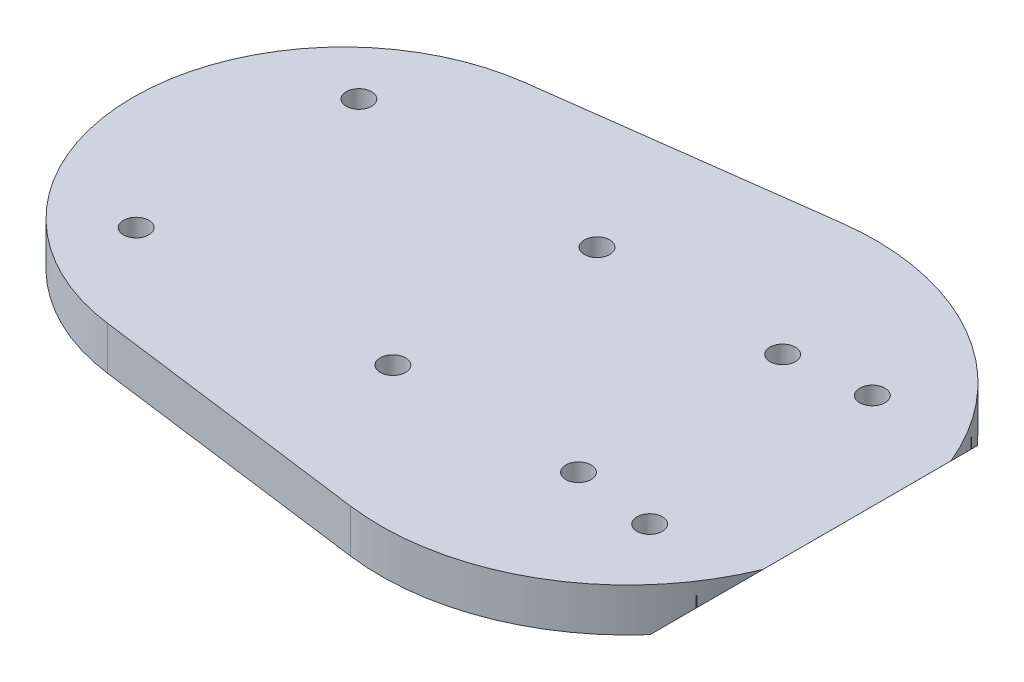
from build123d import *

# Parameters (mm, degrees)
BOSS_EXTRUDE1_DEPTH  = 2
BOSS_EXTRUDE2_DEPTH  = 5
SKETCH3_W            = 1.6
SKETCH3_H            = 48.763225696
BOSS_EXTRUDE3_DEPTH  = 5
SKETCH4_W            = 1.6
SKETCH4_H            = 64.120558948
BOSS_EXTRUDE4_DEPTH  = 5
SKETCH5_W            = 1.6
SKETCH5_H            = 65.99612555
BOSS_EXTRUDE5_DEPTH  = 5
SKETCH6_W            = 1.6
SKETCH6_H            = 66.50657452
BOSS_EXTRUDE6_DEPTH  = 5
SKETCH7_W            = 1.6
SKETCH7_H            = 44.463972346
BOSS_EXTRUDE7_DEPTH  = 5
BOSS_EXTRUDE8_DEPTH  = 5
SKETCH9_R            = 5.05
BOSS_EXTRUDE9_DEPTH  = 5
SKETCH10_R           = 5.05
BOSS_EXTRUDE10_DEPTH = 5
SKETCH11_R           = 5.05
BOSS_EXTRUDE11_DEPTH = 5
SKETCH12_R           = 5.05
BOSS_EXTRUDE12_DEPTH = 5
SKETCH13_R           = 5.05
BOSS_EXTRUDE13_DEPTH = 5
SKETCH14_R           = 5.05
BOSS_EXTRUDE14_DEPTH = 5
SKETCH15_R           = 5.05
BOSS_EXTRUDE15_DEPTH = 5
SKETCH16_R           = 5.05
BOSS_EXTRUDE16_DEPTH = 5
SKETCH17_R           = 0.5
BOSS_EXTRUDE17_DEPTH = 1.2
SKETCH18_R           = 2.05
CUT_EXTRUDE1_DEPTH   = 6.7
SKETCH19_R           = 2.05
CUT_EXTRUDE2_DEPTH   = 6.7
SKETCH20_R           = 1.6
CUT_EXTRUDE3_DEPTH   = 8
CUT_EXTRUDE4_DEPTH   = 160


with BuildPart() as part:
    # Sketch1 → Boss-Extrude1 (new body)
    with BuildSketch(Plane(origin=(0, 28, 0), x_dir=(1, 0, 0), z_dir=(0, 1, 0))):
        with BuildLine():
            Line((256.074935441, -319.290465693), (301.292326745, -313.341724344))
            ThreePointArc((301.292326745, -313.341724344), (346.50971805, -353), (301.292326745, -392.658275656))
            Line((301.292326745, -392.658275656), (256.074935441, -386.709534307))
            ThreePointArc((256.074935441, -386.709534307), (226.50971805, -353), (256.074935441, -319.290465693))
        make_face()
    extrude(amount=BOSS_EXTRUDE1_DEPTH)

    # Sketch2 → Boss-Extrude2 (add)
    with BuildSketch(Plane(origin=(0, 23, 0), x_dir=(1, 0, 0), z_dir=(0, 1, 0))):
        with BuildLine():
            Line((256.074935441, -319.290465693), (301.292326745, -313.341724344))
            ThreePointArc((301.292326745, -313.341724344), (346.50971805, -353), (301.292326745, -392.658275656))
            Line((301.292326745, -392.658275656), (256.074935441, -386.709534307))
            ThreePointArc((256.074935441, -386.709534307), (226.50971805, -353), (256.074935441, -319.290465693))
        make_face()
        with BuildLine():
            Line((256.283631093, -320.876796719), (301.501022397, -314.928055371))
            ThreePointArc((301.501022397, -314.928055371), (344.90971805, -353), (301.501022397, -391.071944629))
            Line((301.501022397, -391.071944629), (256.283631093, -385.123203281))
            ThreePointArc((256.283631093, -385.123203281), (228.10971805, -353), (256.283631093, -320.876796719))
        make_face(mode=Mode.SUBTRACT)
    extrude(amount=BOSS_EXTRUDE2_DEPTH)

    # Sketch3 → Boss-Extrude3 (add)
    with BuildSketch(Plane(origin=(0, 23, 0), x_dir=(1, 0, 0), z_dir=(0, 1, 0))):
        with Locations((238, -353)):
            Rectangle(SKETCH3_W, SKETCH3_H)
    extrude(amount=BOSS_EXTRUDE3_DEPTH)

    # Sketch4 → Boss-Extrude4 (add)
    with BuildSketch(Plane(origin=(0, 23, 0), x_dir=(1, 0, 0), z_dir=(0, 1, 0))):
        with Locations((253, -353)):
            Rectangle(SKETCH4_W, SKETCH4_H)
    extrude(amount=BOSS_EXTRUDE4_DEPTH)

    # Sketch5 → Boss-Extrude5 (add)
    with BuildSketch(Plane(origin=(0, 23, 0), x_dir=(1, 0, 0), z_dir=(0, 1, 0))):
        with Locations((268, -353)):
            Rectangle(SKETCH5_W, SKETCH5_H)
    extrude(amount=BOSS_EXTRUDE5_DEPTH)

    # Sketch6 → Boss-Extrude6 (add)
    with BuildSketch(Plane(origin=(0, 23, 0), x_dir=(1, 0, 0), z_dir=(0, 1, 0))):
        with Locations((327, -353)):
            Rectangle(SKETCH6_W, SKETCH6_H)
    extrude(amount=BOSS_EXTRUDE6_DEPTH)

    # Sketch7 → Boss-Extrude7 (add)
    with BuildSketch(Plane(origin=(0, 23, 0), x_dir=(1, 0, 0), z_dir=(0, 1, 0))):
        with Locations((339, -353)):
            Rectangle(SKETCH7_W, SKETCH7_H)
    extrude(amount=BOSS_EXTRUDE7_DEPTH)

    # Sketch8 → Boss-Extrude8 (add)
    with BuildSketch(Plane(origin=(0, 23, 0), x_dir=(1, 0, 0), z_dir=(0, 1, 0))):
        with BuildLine():
            Line((295, -336), (305, -336))
            ThreePointArc((305, -336), (322, -353), (305, -370))
            Line((305, -370), (295, -370))
            ThreePointArc((295, -370), (278, -353), (295, -336))
        make_face()
        with BuildLine():
            Line((295, -337.6), (305, -337.6))
            ThreePointArc((305, -337.6), (320.4, -353), (305, -368.4))
            Line((305, -368.4), (295, -368.4))
            ThreePointArc((295, -368.4), (279.6, -353), (295, -337.6))
        make_face(mode=Mode.SUBTRACT)
    extrude(amount=BOSS_EXTRUDE8_DEPTH)

    # Sketch9 → Boss-Extrude9 (add)
    with BuildSketch(Plane(origin=(0, 23, 0), x_dir=(1, 0, 0), z_dir=(0, 1, 0))):
        with Locations((285, -336.5)):
            Circle(SKETCH9_R)
    extrude(amount=BOSS_EXTRUDE9_DEPTH)

    # Sketch10 → Boss-Extrude10 (add)
    with BuildSketch(Plane(origin=(0, 23, 0), x_dir=(1, 0, 0), z_dir=(0, 1, 0))):
        with Locations((285, -369.5)):
            Circle(SKETCH10_R)
    extrude(amount=BOSS_EXTRUDE10_DEPTH)

    # Sketch11 → Boss-Extrude11 (add)
    with BuildSketch(Plane(origin=(0, 23, 0), x_dir=(1, 0, 0), z_dir=(0, 1, 0))):
        with Locations((315, -336.5)):
            Circle(SKETCH11_R)
    extrude(amount=BOSS_EXTRUDE11_DEPTH)

    # Sketch12 → Boss-Extrude12 (add)
    with BuildSketch(Plane(origin=(0, 23, 0), x_dir=(1, 0, 0), z_dir=(0, 1, 0))):
        with Locations((315, -369.5)):
            Circle(SKETCH12_R)
    extrude(amount=BOSS_EXTRUDE12_DEPTH)

    # Sketch13 → Boss-Extrude13 (add)
    with BuildSketch(Plane(origin=(0, 23, 0), x_dir=(1, 0, 0), z_dir=(0, 1, 0))):
        with Locations((328, -335)):
            Circle(SKETCH13_R)
    extrude(amount=BOSS_EXTRUDE13_DEPTH)

    # Sketch14 → Boss-Extrude14 (add)
    with BuildSketch(Plane(origin=(0, 23, 0), x_dir=(1, 0, 0), z_dir=(0, 1, 0))):
        with Locations((328, -371)):
            Circle(SKETCH14_R)
    extrude(amount=BOSS_EXTRUDE14_DEPTH)

    # Sketch15 → Boss-Extrude15 (add)
    with BuildSketch(Plane(origin=(0, 23, 0), x_dir=(1, 0, 0), z_dir=(0, 1, 0))):
        with Locations((245, -335)):
            Circle(SKETCH15_R)
    extrude(amount=BOSS_EXTRUDE15_DEPTH)

    # Sketch16 → Boss-Extrude16 (add)
    with BuildSketch(Plane(origin=(0, 23, 0), x_dir=(1, 0, 0), z_dir=(0, 1, 0))):
        with Locations((245, -371)):
            Circle(SKETCH16_R)
    extrude(amount=BOSS_EXTRUDE16_DEPTH)

    # Sketch17 → Boss-Extrude17 (add)
    with BuildSketch(Plane(origin=(0, 26.8, 0), x_dir=(1, 0, 0), z_dir=(0, 1, 0))):
        with Locations((232.50971805, -337.812698478)):
            Circle(SKETCH17_R)
        with Locations((232.50971805, -340.312698478)):
            Circle(SKETCH17_R)
        with Locations((232.50971805, -342.812698478)):
            Circle(SKETCH17_R)
        with Locations((232.50971805, -345.312698478)):
            Circle(SKETCH17_R)
        with Locations((232.50971805, -347.812698478)):
            Circle(SKETCH17_R)
        with Locations((232.50971805, -350.312698478)):
            Circle(SKETCH17_R)
        with Locations((232.50971805, -352.812698478)):
            Circle(SKETCH17_R)
        with Locations((232.50971805, -355.312698478)):
            Circle(SKETCH17_R)
        with Locations((232.50971805, -357.812698478)):
            Circle(SKETCH17_R)
        with Locations((232.50971805, -360.312698478)):
            Circle(SKETCH17_R)
        with Locations((232.50971805, -362.812698478)):
            Circle(SKETCH17_R)
        with Locations((232.50971805, -365.312698478)):
            Circle(SKETCH17_R)
        with Locations((232.50971805, -367.812698478)):
            Circle(SKETCH17_R)
        with Locations((235.00971805, -334.611113856)):
            Circle(SKETCH17_R)
        with Locations((235.00971805, -337.111113856)):
            Circle(SKETCH17_R)
        with Locations((235.00971805, -339.611113856)):
            Circle(SKETCH17_R)
        with Locations((235.00971805, -342.111113856)):
            Circle(SKETCH17_R)
        with Locations((235.00971805, -344.611113856)):
            Circle(SKETCH17_R)
        with Locations((235.00971805, -347.111113856)):
            Circle(SKETCH17_R)
        with Locations((235.00971805, -349.611113856)):
            Circle(SKETCH17_R)
        with Locations((235.00971805, -352.111113856)):
            Circle(SKETCH17_R)
        with Locations((235.00971805, -354.611113856)):
            Circle(SKETCH17_R)
        with Locations((235.00971805, -357.111113856)):
            Circle(SKETCH17_R)
        with Locations((235.00971805, -359.611113856)):
            Circle(SKETCH17_R)
        with Locations((235.00971805, -362.111113856)):
            Circle(SKETCH17_R)
        with Locations((235.00971805, -364.611113856)):
            Circle(SKETCH17_R)
        with Locations((235.00971805, -367.111113856)):
            Circle(SKETCH17_R)
        with Locations((235.00971805, -369.611113856)):
            Circle(SKETCH17_R)
        with Locations((242.50971805, -328.255589796)):
            Circle(SKETCH17_R)
        with Locations((242.50971805, -343.255589796)):
            Circle(SKETCH17_R)
        with Locations((242.50971805, -345.755589796)):
            Circle(SKETCH17_R)
        with Locations((242.50971805, -348.255589796)):
            Circle(SKETCH17_R)
        with Locations((242.50971805, -350.755589796)):
            Circle(SKETCH17_R)
        with Locations((242.50971805, -353.255589796)):
            Circle(SKETCH17_R)
        with Locations((242.50971805, -355.755589796)):
            Circle(SKETCH17_R)
        with Locations((242.50971805, -358.255589796)):
            Circle(SKETCH17_R)
        with Locations((242.50971805, -360.755589796)):
            Circle(SKETCH17_R)
        with Locations((242.50971805, -363.255589796)):
            Circle(SKETCH17_R)
        with Locations((245.00971805, -326.838638497)):
            Circle(SKETCH17_R)
        with Locations((245.00971805, -341.838638497)):
            Circle(SKETCH17_R)
        with Locations((245.00971805, -344.338638497)):
            Circle(SKETCH17_R)
        with Locations((245.00971805, -346.838638497)):
            Circle(SKETCH17_R)
        with Locations((245.00971805, -349.338638497)):
            Circle(SKETCH17_R)
        with Locations((245.00971805, -351.838638497)):
            Circle(SKETCH17_R)
        with Locations((245.00971805, -354.338638497)):
            Circle(SKETCH17_R)
        with Locations((245.00971805, -356.838638497)):
            Circle(SKETCH17_R)
        with Locations((245.00971805, -359.338638497)):
            Circle(SKETCH17_R)
        with Locations((245.00971805, -361.838638497)):
            Circle(SKETCH17_R)
        with Locations((245.00971805, -364.338638497)):
            Circle(SKETCH17_R)
        with Locations((247.50971805, -325.683443855)):
            Circle(SKETCH17_R)
        with Locations((247.50971805, -328.183443855)):
            Circle(SKETCH17_R)
        with Locations((247.50971805, -343.183443855)):
            Circle(SKETCH17_R)
        with Locations((247.50971805, -345.683443855)):
            Circle(SKETCH17_R)
        with Locations((247.50971805, -348.183443855)):
            Circle(SKETCH17_R)
        with Locations((247.50971805, -350.683443855)):
            Circle(SKETCH17_R)
        with Locations((247.50971805, -353.183443855)):
            Circle(SKETCH17_R)
        with Locations((247.50971805, -355.683443855)):
            Circle(SKETCH17_R)
        with Locations((247.50971805, -358.183443855)):
            Circle(SKETCH17_R)
        with Locations((247.50971805, -360.683443855)):
            Circle(SKETCH17_R)
        with Locations((247.50971805, -363.183443855)):
            Circle(SKETCH17_R)
        with Locations((247.50971805, -378.183443855)):
            Circle(SKETCH17_R)
        with Locations((250.00971805, -324.761941926)):
            Circle(SKETCH17_R)
        with Locations((250.00971805, -327.261941926)):
            Circle(SKETCH17_R)
        with Locations((250.00971805, -329.761941926)):
            Circle(SKETCH17_R)
        with Locations((250.00971805, -339.761941926)):
            Circle(SKETCH17_R)
        with Locations((250.00971805, -342.261941926)):
            Circle(SKETCH17_R)
        with Locations((250.00971805, -344.761941926)):
            Circle(SKETCH17_R)
        with Locations((250.00971805, -347.261941926)):
            Circle(SKETCH17_R)
        with Locations((250.00971805, -349.761941926)):
            Circle(SKETCH17_R)
        with Locations((250.00971805, -352.261941926)):
            Circle(SKETCH17_R)
        with Locations((250.00971805, -354.761941926)):
            Circle(SKETCH17_R)
        with Locations((250.00971805, -357.261941926)):
            Circle(SKETCH17_R)
        with Locations((250.00971805, -359.761941926)):
            Circle(SKETCH17_R)
        with Locations((250.00971805, -362.261941926)):
            Circle(SKETCH17_R)
        with Locations((250.00971805, -364.761941926)):
            Circle(SKETCH17_R)
        with Locations((250.00971805, -377.261941926)):
            Circle(SKETCH17_R)
        with Locations((250.00971805, -379.761941926)):
            Circle(SKETCH17_R)
        with Locations((257.50971805, -323.232611556)):
            Circle(SKETCH17_R)
        with Locations((257.50971805, -325.732611556)):
            Circle(SKETCH17_R)
        with Locations((257.50971805, -328.232611556)):
            Circle(SKETCH17_R)
        with Locations((257.50971805, -330.732611556)):
            Circle(SKETCH17_R)
        with Locations((257.50971805, -333.232611556)):
            Circle(SKETCH17_R)
        with Locations((257.50971805, -335.732611556)):
            Circle(SKETCH17_R)
        with Locations((257.50971805, -338.232611556)):
            Circle(SKETCH17_R)
        with Locations((257.50971805, -340.732611556)):
            Circle(SKETCH17_R)
        with Locations((257.50971805, -343.232611556)):
            Circle(SKETCH17_R)
        with Locations((257.50971805, -345.732611556)):
            Circle(SKETCH17_R)
        with Locations((257.50971805, -348.232611556)):
            Circle(SKETCH17_R)
        with Locations((257.50971805, -350.732611556)):
            Circle(SKETCH17_R)
        with Locations((257.50971805, -353.232611556)):
            Circle(SKETCH17_R)
        with Locations((257.50971805, -355.732611556)):
            Circle(SKETCH17_R)
        with Locations((257.50971805, -358.232611556)):
            Circle(SKETCH17_R)
        with Locations((257.50971805, -360.732611556)):
            Circle(SKETCH17_R)
        with Locations((257.50971805, -363.232611556)):
            Circle(SKETCH17_R)
        with Locations((257.50971805, -365.732611556)):
            Circle(SKETCH17_R)
        with Locations((257.50971805, -368.232611556)):
            Circle(SKETCH17_R)
        with Locations((257.50971805, -370.732611556)):
            Circle(SKETCH17_R)
        with Locations((257.50971805, -373.232611556)):
            Circle(SKETCH17_R)
        with Locations((257.50971805, -375.732611556)):
            Circle(SKETCH17_R)
        with Locations((257.50971805, -378.232611556)):
            Circle(SKETCH17_R)
        with Locations((257.50971805, -380.732611556)):
            Circle(SKETCH17_R)
        with Locations((260.00971805, -323.103676669)):
            Circle(SKETCH17_R)
        with Locations((260.00971805, -325.603676669)):
            Circle(SKETCH17_R)
        with Locations((260.00971805, -328.103676669)):
            Circle(SKETCH17_R)
        with Locations((260.00971805, -330.603676669)):
            Circle(SKETCH17_R)
        with Locations((260.00971805, -333.103676669)):
            Circle(SKETCH17_R)
        with Locations((260.00971805, -335.603676669)):
            Circle(SKETCH17_R)
        with Locations((260.00971805, -338.103676669)):
            Circle(SKETCH17_R)
        with Locations((260.00971805, -340.603676669)):
            Circle(SKETCH17_R)
        with Locations((260.00971805, -343.103676669)):
            Circle(SKETCH17_R)
        with Locations((260.00971805, -345.603676669)):
            Circle(SKETCH17_R)
        with Locations((260.00971805, -348.103676669)):
            Circle(SKETCH17_R)
        with Locations((260.00971805, -350.603676669)):
            Circle(SKETCH17_R)
        with Locations((260.00971805, -353.103676669)):
            Circle(SKETCH17_R)
        with Locations((260.00971805, -355.603676669)):
            Circle(SKETCH17_R)
        with Locations((260.00971805, -358.103676669)):
            Circle(SKETCH17_R)
        with Locations((260.00971805, -360.603676669)):
            Circle(SKETCH17_R)
        with Locations((260.00971805, -363.103676669)):
            Circle(SKETCH17_R)
        with Locations((260.00971805, -365.603676669)):
            Circle(SKETCH17_R)
        with Locations((260.00971805, -368.103676669)):
            Circle(SKETCH17_R)
        with Locations((260.00971805, -370.603676669)):
            Circle(SKETCH17_R)
        with Locations((260.00971805, -373.103676669)):
            Circle(SKETCH17_R)
        with Locations((260.00971805, -375.603676669)):
            Circle(SKETCH17_R)
        with Locations((260.00971805, -378.103676669)):
            Circle(SKETCH17_R)
        with Locations((260.00971805, -380.603676669)):
            Circle(SKETCH17_R)
        with Locations((262.50971805, -323.158874503)):
            Circle(SKETCH17_R)
        with Locations((262.50971805, -325.658874503)):
            Circle(SKETCH17_R)
        with Locations((262.50971805, -328.158874503)):
            Circle(SKETCH17_R)
        with Locations((262.50971805, -330.658874503)):
            Circle(SKETCH17_R)
        with Locations((262.50971805, -333.158874503)):
            Circle(SKETCH17_R)
        with Locations((262.50971805, -335.658874503)):
            Circle(SKETCH17_R)
        with Locations((262.50971805, -338.158874503)):
            Circle(SKETCH17_R)
        with Locations((262.50971805, -340.658874503)):
            Circle(SKETCH17_R)
        with Locations((262.50971805, -343.158874503)):
            Circle(SKETCH17_R)
        with Locations((262.50971805, -345.658874503)):
            Circle(SKETCH17_R)
        with Locations((262.50971805, -348.158874503)):
            Circle(SKETCH17_R)
        with Locations((262.50971805, -350.658874503)):
            Circle(SKETCH17_R)
        with Locations((262.50971805, -353.158874503)):
            Circle(SKETCH17_R)
        with Locations((262.50971805, -355.658874503)):
            Circle(SKETCH17_R)
        with Locations((262.50971805, -358.158874503)):
            Circle(SKETCH17_R)
        with Locations((262.50971805, -360.658874503)):
            Circle(SKETCH17_R)
        with Locations((262.50971805, -363.158874503)):
            Circle(SKETCH17_R)
        with Locations((262.50971805, -365.658874503)):
            Circle(SKETCH17_R)
        with Locations((262.50971805, -368.158874503)):
            Circle(SKETCH17_R)
        with Locations((262.50971805, -370.658874503)):
            Circle(SKETCH17_R)
        with Locations((262.50971805, -373.158874503)):
            Circle(SKETCH17_R)
        with Locations((262.50971805, -375.658874503)):
            Circle(SKETCH17_R)
        with Locations((262.50971805, -378.158874503)):
            Circle(SKETCH17_R)
        with Locations((262.50971805, -380.658874503)):
            Circle(SKETCH17_R)
        with Locations((265.00971805, -323.382172838)):
            Circle(SKETCH17_R)
        with Locations((265.00971805, -325.882172838)):
            Circle(SKETCH17_R)
        with Locations((265.00971805, -328.382172838)):
            Circle(SKETCH17_R)
        with Locations((265.00971805, -330.882172838)):
            Circle(SKETCH17_R)
        with Locations((265.00971805, -333.382172838)):
            Circle(SKETCH17_R)
        with Locations((265.00971805, -335.882172838)):
            Circle(SKETCH17_R)
        with Locations((265.00971805, -338.382172838)):
            Circle(SKETCH17_R)
        with Locations((265.00971805, -340.882172838)):
            Circle(SKETCH17_R)
        with Locations((265.00971805, -343.382172838)):
            Circle(SKETCH17_R)
        with Locations((265.00971805, -345.882172838)):
            Circle(SKETCH17_R)
        with Locations((265.00971805, -348.382172838)):
            Circle(SKETCH17_R)
        with Locations((265.00971805, -350.882172838)):
            Circle(SKETCH17_R)
        with Locations((265.00971805, -353.382172838)):
            Circle(SKETCH17_R)
        with Locations((265.00971805, -355.882172838)):
            Circle(SKETCH17_R)
        with Locations((265.00971805, -358.382172838)):
            Circle(SKETCH17_R)
        with Locations((265.00971805, -360.882172838)):
            Circle(SKETCH17_R)
        with Locations((265.00971805, -363.382172838)):
            Circle(SKETCH17_R)
        with Locations((265.00971805, -365.882172838)):
            Circle(SKETCH17_R)
        with Locations((265.00971805, -368.382172838)):
            Circle(SKETCH17_R)
        with Locations((265.00971805, -370.882172838)):
            Circle(SKETCH17_R)
        with Locations((265.00971805, -373.382172838)):
            Circle(SKETCH17_R)
        with Locations((265.00971805, -375.882172838)):
            Circle(SKETCH17_R)
        with Locations((265.00971805, -378.382172838)):
            Circle(SKETCH17_R)
        with Locations((265.00971805, -380.882172838)):
            Circle(SKETCH17_R)
        with Locations((272.50971805, -322.428494508)):
            Circle(SKETCH17_R)
        with Locations((272.50971805, -324.928494508)):
            Circle(SKETCH17_R)
        with Locations((272.50971805, -327.428494508)):
            Circle(SKETCH17_R)
        with Locations((272.50971805, -329.928494508)):
            Circle(SKETCH17_R)
        with Locations((272.50971805, -332.428494508)):
            Circle(SKETCH17_R)
        with Locations((272.50971805, -334.928494508)):
            Circle(SKETCH17_R)
        with Locations((272.50971805, -337.428494508)):
            Circle(SKETCH17_R)
        with Locations((272.50971805, -339.928494508)):
            Circle(SKETCH17_R)
        with Locations((272.50971805, -342.428494508)):
            Circle(SKETCH17_R)
        with Locations((272.50971805, -344.928494508)):
            Circle(SKETCH17_R)
        with Locations((272.50971805, -347.428494508)):
            Circle(SKETCH17_R)
        with Locations((272.50971805, -349.928494508)):
            Circle(SKETCH17_R)
        with Locations((272.50971805, -352.428494508)):
            Circle(SKETCH17_R)
        with Locations((272.50971805, -354.928494508)):
            Circle(SKETCH17_R)
        with Locations((272.50971805, -357.428494508)):
            Circle(SKETCH17_R)
        with Locations((272.50971805, -359.928494508)):
            Circle(SKETCH17_R)
        with Locations((272.50971805, -362.428494508)):
            Circle(SKETCH17_R)
        with Locations((272.50971805, -364.928494508)):
            Circle(SKETCH17_R)
        with Locations((272.50971805, -367.428494508)):
            Circle(SKETCH17_R)
        with Locations((272.50971805, -369.928494508)):
            Circle(SKETCH17_R)
        with Locations((272.50971805, -372.428494508)):
            Circle(SKETCH17_R)
        with Locations((272.50971805, -374.928494508)):
            Circle(SKETCH17_R)
        with Locations((272.50971805, -377.428494508)):
            Circle(SKETCH17_R)
        with Locations((272.50971805, -379.928494508)):
            Circle(SKETCH17_R)
        with Locations((272.50971805, -382.428494508)):
            Circle(SKETCH17_R)
        with Locations((275.00971805, -322.110601732)):
            Circle(SKETCH17_R)
        with Locations((275.00971805, -324.610601732)):
            Circle(SKETCH17_R)
        with Locations((275.00971805, -327.110601732)):
            Circle(SKETCH17_R)
        with Locations((275.00971805, -329.610601732)):
            Circle(SKETCH17_R)
        with Locations((275.00971805, -332.110601732)):
            Circle(SKETCH17_R)
        with Locations((275.00971805, -334.610601732)):
            Circle(SKETCH17_R)
        with Locations((275.00971805, -337.110601732)):
            Circle(SKETCH17_R)
        with Locations((275.00971805, -339.610601732)):
            Circle(SKETCH17_R)
        with Locations((275.00971805, -342.110601732)):
            Circle(SKETCH17_R)
        with Locations((275.00971805, -344.610601732)):
            Circle(SKETCH17_R)
        with Locations((275.00971805, -347.110601732)):
            Circle(SKETCH17_R)
        with Locations((275.00971805, -349.610601732)):
            Circle(SKETCH17_R)
        with Locations((275.00971805, -352.110601732)):
            Circle(SKETCH17_R)
        with Locations((275.00971805, -354.610601732)):
            Circle(SKETCH17_R)
        with Locations((275.00971805, -357.110601732)):
            Circle(SKETCH17_R)
        with Locations((275.00971805, -359.610601732)):
            Circle(SKETCH17_R)
        with Locations((275.00971805, -362.110601732)):
            Circle(SKETCH17_R)
        with Locations((275.00971805, -364.610601732)):
            Circle(SKETCH17_R)
        with Locations((275.00971805, -367.110601732)):
            Circle(SKETCH17_R)
        with Locations((275.00971805, -369.610601732)):
            Circle(SKETCH17_R)
        with Locations((275.00971805, -372.110601732)):
            Circle(SKETCH17_R)
        with Locations((275.00971805, -374.610601732)):
            Circle(SKETCH17_R)
        with Locations((275.00971805, -377.110601732)):
            Circle(SKETCH17_R)
        with Locations((275.00971805, -379.610601732)):
            Circle(SKETCH17_R)
        with Locations((275.00971805, -382.110601732)):
            Circle(SKETCH17_R)
        with Locations((330.00971805, -324.731033381)):
            Circle(SKETCH17_R)
        with Locations((330.00971805, -327.231033381)):
            Circle(SKETCH17_R)
        with Locations((330.00971805, -342.231033381)):
            Circle(SKETCH17_R)
        with Locations((330.00971805, -344.731033381)):
            Circle(SKETCH17_R)
        with Locations((330.00971805, -347.231033381)):
            Circle(SKETCH17_R)
        with Locations((330.00971805, -349.731033381)):
            Circle(SKETCH17_R)
        with Locations((330.00971805, -352.231033381)):
            Circle(SKETCH17_R)
        with Locations((330.00971805, -354.731033381)):
            Circle(SKETCH17_R)
        with Locations((330.00971805, -357.231033381)):
            Circle(SKETCH17_R)
        with Locations((330.00971805, -359.731033381)):
            Circle(SKETCH17_R)
        with Locations((330.00971805, -362.231033381)):
            Circle(SKETCH17_R)
        with Locations((330.00971805, -364.731033381)):
            Circle(SKETCH17_R)
        with Locations((330.00971805, -379.731033381)):
            Circle(SKETCH17_R)
        with Locations((332.50971805, -326.702631693)):
            Circle(SKETCH17_R)
        with Locations((332.50971805, -329.202631693)):
            Circle(SKETCH17_R)
        with Locations((332.50971805, -341.702631693)):
            Circle(SKETCH17_R)
        with Locations((332.50971805, -344.202631693)):
            Circle(SKETCH17_R)
        with Locations((332.50971805, -346.702631693)):
            Circle(SKETCH17_R)
        with Locations((332.50971805, -349.202631693)):
            Circle(SKETCH17_R)
        with Locations((332.50971805, -351.702631693)):
            Circle(SKETCH17_R)
        with Locations((332.50971805, -354.202631693)):
            Circle(SKETCH17_R)
        with Locations((332.50971805, -356.702631693)):
            Circle(SKETCH17_R)
        with Locations((332.50971805, -359.202631693)):
            Circle(SKETCH17_R)
        with Locations((332.50971805, -361.702631693)):
            Circle(SKETCH17_R)
        with Locations((332.50971805, -364.202631693)):
            Circle(SKETCH17_R)
        with Locations((332.50971805, -376.702631693)):
            Circle(SKETCH17_R)
        with Locations((332.50971805, -379.202631693)):
            Circle(SKETCH17_R)
        with Locations((335.00971805, -329.033115599)):
            Circle(SKETCH17_R)
        with Locations((335.00971805, -331.533115599)):
            Circle(SKETCH17_R)
        with Locations((335.00971805, -334.033115599)):
            Circle(SKETCH17_R)
        with Locations((335.00971805, -336.533115599)):
            Circle(SKETCH17_R)
        with Locations((335.00971805, -339.033115599)):
            Circle(SKETCH17_R)
        with Locations((335.00971805, -341.533115599)):
            Circle(SKETCH17_R)
        with Locations((335.00971805, -344.033115599)):
            Circle(SKETCH17_R)
        with Locations((335.00971805, -346.533115599)):
            Circle(SKETCH17_R)
        with Locations((335.00971805, -349.033115599)):
            Circle(SKETCH17_R)
        with Locations((335.00971805, -351.533115599)):
            Circle(SKETCH17_R)
        with Locations((335.00971805, -354.033115599)):
            Circle(SKETCH17_R)
        with Locations((335.00971805, -356.533115599)):
            Circle(SKETCH17_R)
        with Locations((335.00971805, -359.033115599)):
            Circle(SKETCH17_R)
        with Locations((335.00971805, -361.533115599)):
            Circle(SKETCH17_R)
        with Locations((335.00971805, -364.033115599)):
            Circle(SKETCH17_R)
        with Locations((335.00971805, -366.533115599)):
            Circle(SKETCH17_R)
        with Locations((335.00971805, -369.033115599)):
            Circle(SKETCH17_R)
        with Locations((335.00971805, -371.533115599)):
            Circle(SKETCH17_R)
        with Locations((335.00971805, -374.033115599)):
            Circle(SKETCH17_R)
        with Locations((335.00971805, -376.533115599)):
            Circle(SKETCH17_R)
    extrude(amount=BOSS_EXTRUDE17_DEPTH)

    # Sketch18 → Cut-Extrude1 (cut)
    with BuildSketch(Plane(origin=(0, 23.3, 0), x_dir=(1, 0, 0), z_dir=(0, 1, 0))):
        with Locations((285, -336.5)):
            Circle(SKETCH18_R)
        with Locations((285, -369.5)):
            Circle(SKETCH18_R)
        with Locations((315, -336.5)):
            Circle(SKETCH18_R)
        with Locations((315, -369.5)):
            Circle(SKETCH18_R)
    extrude(amount=CUT_EXTRUDE1_DEPTH, mode=Mode.SUBTRACT)

    # Sketch19 → Cut-Extrude2 (cut)
    with BuildSketch(Plane(origin=(0, 23.3, 0), x_dir=(1, 0, 0), z_dir=(0, 1, 0))):
        with Locations((328, -335)):
            Circle(SKETCH19_R)
        with Locations((328, -371)):
            Circle(SKETCH19_R)
        with Locations((245, -335)):
            Circle(SKETCH19_R)
        with Locations((245, -371)):
            Circle(SKETCH19_R)
    extrude(amount=CUT_EXTRUDE2_DEPTH, mode=Mode.SUBTRACT)

    # Sketch20 → Cut-Extrude3 (cut)
    with BuildSketch(Plane(origin=(0, 22, 0), x_dir=(1, 0, 0), z_dir=(0, 1, 0))):
        with Locations((328, -335)):
            Circle(SKETCH20_R)
        with Locations((328, -371)):
            Circle(SKETCH20_R)
        with Locations((245, -335)):
            Circle(SKETCH20_R)
        with Locations((245, -371)):
            Circle(SKETCH20_R)
    extrude(amount=CUT_EXTRUDE3_DEPTH, mode=Mode.SUBTRACT)

    # Sketch21 → Cut-Extrude4 (cut)
    with BuildSketch(Plane.XY.offset(273)):
        Polygon((336.50971805, 22.99), (348.50971805, 22.99), (348.50971805, 35), align=None)
    extrude(amount=CUT_EXTRUDE4_DEPTH, mode=Mode.SUBTRACT)


solid = part.part
